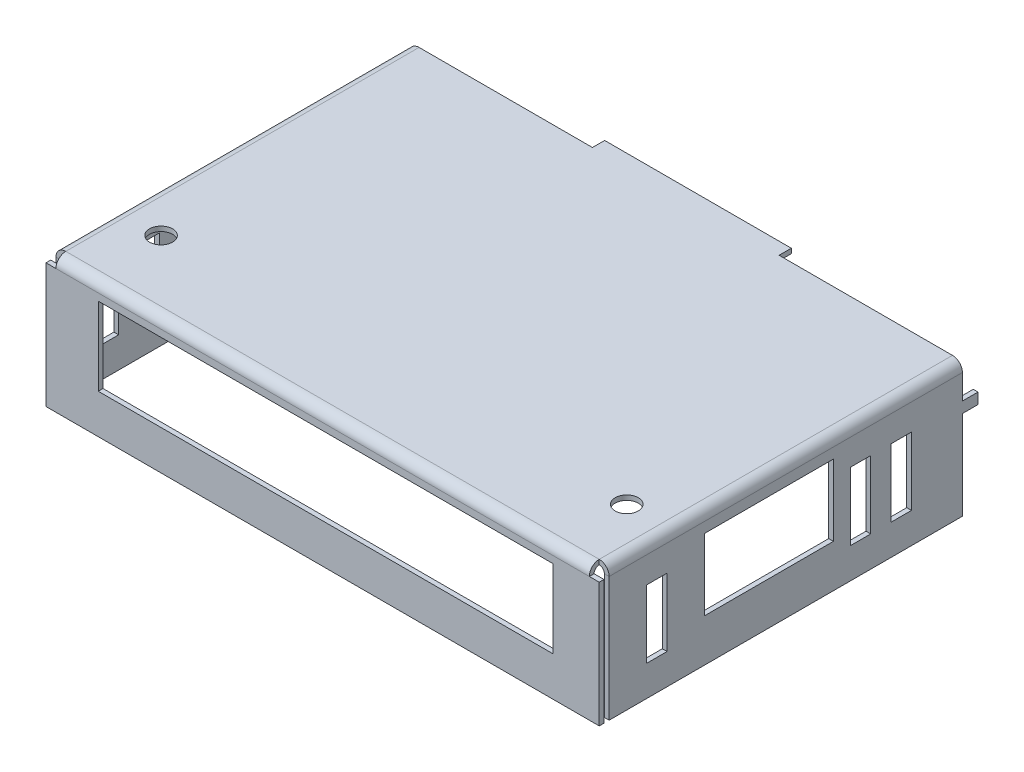
from build123d import *

# Parameters (mm, degrees)
SKETCH1_W                = 78.58
SKETCH1_H                = 52.04
BOSS_EXTRUDE1_DEPTH      = 0.7
EDGE_FLANGE2_DEPTH       = 52.04
EDGE_FLANGE1_START       = -39.29
EDGE_FLANGE1_DEPTH       = 78.58
EDGE_FLANGE1_START_2     = -40.75
EDGE_FLANGE1_2_OUTLINE_W = 18.34
EDGE_FLANGE1_2_OUTLINE_H = 0.7
EDGE_FLANGE1_2_DEPTH     = 81.5
CUT_EXTRUDE1_REACH       = 90.258
SKETCH12_W               = 3
SKETCH12_H               = 10
LPATTERN1_COUNT          = 7
LPATTERN1_PITCH          = 6
SKETCH13_W               = 3
SKETCH13_H               = 10
CUT_EXTRUDE2_DEPTH       = 88.611816555
CUT_EXTRUDE3_REACH       = 90.258
SKETCH14_W               = 19
SKETCH14_H               = 10.5
SKETCH15_W               = 0.7
SKETCH15_H               = 1.6
BOSS_EXTRUDE2_DEPTH      = 2.3
CUT_EXTRUDE4_REACH       = 73.877
SKETCH16_W               = 67
SKETCH16_H               = 11.5
SKETCH17_W               = 27.5
SKETCH17_H               = 0.7
BOSS_EXTRUDE3_DEPTH      = 1.8
M3_CLEARANCE_HOLE2_D     = 3.4


# Read off the part's stored shape, not the designer's step: Edge-Flange1
# Sheet-metal steps are written as plain solids
with BuildPart() as part:
    # Sketch1 → Boss-Extrude1 (new body)
    with BuildSketch(Plane(origin=(0, 0, 0), x_dir=(1, 0, 0), z_dir=(0, 1, 0))):
        Rectangle(SKETCH1_W, SKETCH1_H)
    extrude(amount=-BOSS_EXTRUDE1_DEPTH)

    # Edge-Flange2 section (across the edge) → Edge-Flange2 (add)
    with BuildSketch(Plane(origin=(40.05, -0.7, -26.02), x_dir=(-1, 0, 0), z_dir=(0, 0, 1))):
        with BuildLine():
            Line((-0.7, 0.76), (-0.7, 19.1))
            Line((-0.7, 19.1), (0, 19.1))
            Line((0, 19.1), (0, 0.76))
            ThreePointArc((0, 0.76), (0.222598846, 0.222598846), (0.76, 0))
            Line((0.76, 0), (0.76, -0.7))
            ThreePointArc((0.76, -0.7), (-0.272375901, -0.272375901), (-0.7, 0.76))
        make_face()
    edge_flange2 = extrude(amount=EDGE_FLANGE2_DEPTH)

    # Mirror1: Edge-Flange2 across plane
    add(edge_flange2.mirror(Plane(origin=(0, 0, 0), x_dir=(0, 0, 1), z_dir=(1, 0, 0))))

    # Edge-Flange1 outline → Edge-Flange1 (add)
    with BuildSketch(Plane.YZ.offset(EDGE_FLANGE1_START)):
        with BuildLine():
            Line((-1.46, 27.48), (-19.8, 27.48))
            Line((-19.8, 27.48), (-19.8, 26.78))
            Line((-19.8, 26.78), (-1.46, 26.78))
            ThreePointArc((-1.46, 26.78), (-0.922598846, 26.557401154), (-0.7, 26.02))
            Line((-0.7, 26.02), (0, 26.02))
            ThreePointArc((0, 26.02), (-0.427624099, 27.052375901), (-1.46, 27.48))
        make_face()
    extrude(amount=EDGE_FLANGE1_DEPTH)

    # Edge-Flange1 2 outline → Edge-Flange1 2 (add)
    with BuildSketch(Plane.YZ.offset(EDGE_FLANGE1_START_2)):
        with Locations((-10.63, 27.13)):
            Rectangle(EDGE_FLANGE1_2_OUTLINE_W, EDGE_FLANGE1_2_OUTLINE_H)
    extrude(amount=EDGE_FLANGE1_2_DEPTH)

    # Sketch12 → Cut-Extrude1 (cut, up to next)
    with BuildSketch(Plane.ZY.offset(40.75), mode=Mode.PRIVATE) as cut_extrude1_sk1:
        with Locations((-17.02, -10.3)):
            Rectangle(SKETCH12_W, SKETCH12_H)
    cut_extrude1_tool1 = extrude(cut_extrude1_sk1.sketch, amount=-CUT_EXTRUDE1_REACH, mode=Mode.PRIVATE) & part.part
    cut_extrude1 = cut_extrude1_tool1.solids().sort_by_distance((-40.75, -10.3, -17.02))[0]
    add(cut_extrude1, mode=Mode.SUBTRACT)

    # LPattern1: Cut-Extrude1 ×7
    with Locations(*[(0, 0, i * LPATTERN1_PITCH) for i in range(1, LPATTERN1_COUNT)]):
        add(cut_extrude1, mode=Mode.SUBTRACT)

    # Sketch13 → Cut-Extrude2 (cut, through all)
    with BuildSketch(Plane.ZY.offset(-40.05)):
        with Locations((18.98, -10.3)):
            Rectangle(SKETCH13_W, SKETCH13_H)
        with Locations((-11.02, -10.3)):
            Rectangle(SKETCH13_W, SKETCH13_H)
        with Locations((-17.02, -10.3)):
            Rectangle(SKETCH13_W, SKETCH13_H)
    extrude(amount=-CUT_EXTRUDE2_DEPTH, mode=Mode.SUBTRACT)

    # Sketch14 → Cut-Extrude3 (cut, up to next)
    with BuildSketch(Plane(origin=(40.75, 0, 0), x_dir=(0, 0, -1), z_dir=(1, 0, 0)), mode=Mode.PRIVATE) as cut_extrude3_sk1:
        with Locations((-2.48, -8.25)):
            Rectangle(SKETCH14_W, SKETCH14_H)
    cut_extrude3_tool1 = extrude(cut_extrude3_sk1.sketch, amount=-CUT_EXTRUDE3_REACH, mode=Mode.PRIVATE) & part.part
    add(cut_extrude3_tool1.solids().sort_by_distance((40.75, -8.25, 2.48))[0], mode=Mode.SUBTRACT)

    # Sketch15 → Boss-Extrude2 (add)
    with BuildSketch(Plane(origin=(0, 0, -26.02), x_dir=(-1, 0, 0), z_dir=(0, 0, -1))):
        with Locations((-40.4, -5.9)):
            Rectangle(SKETCH15_W, SKETCH15_H)
    boss_extrude2 = extrude(amount=BOSS_EXTRUDE2_DEPTH)

    # Mirror2: Boss-Extrude2 across plane
    add(boss_extrude2.mirror(Plane(origin=(0, 0, 0), x_dir=(0, 0, 1), z_dir=(1, 0, 0))))

    # Sketch16 → Cut-Extrude4 (cut, up to next)
    with BuildSketch(Plane.XY.offset(27.48), mode=Mode.PRIVATE) as cut_extrude4_sk1:
        with Locations((0.45, -8.25)):
            Rectangle(SKETCH16_W, SKETCH16_H)
    cut_extrude4_tool1 = extrude(cut_extrude4_sk1.sketch, amount=-CUT_EXTRUDE4_REACH, mode=Mode.PRIVATE) & part.part
    add(cut_extrude4_tool1.solids().sort_by_distance((0.45, -8.25, 27.48))[0], mode=Mode.SUBTRACT)

    # Sketch17 → Boss-Extrude3 (add)
    with BuildSketch(Plane(origin=(0, 0, -26.02), x_dir=(-1, 0, 0), z_dir=(0, 0, -1))):
        with Locations((0, -0.35)):
            Rectangle(SKETCH17_W, SKETCH17_H)
    extrude(amount=BOSS_EXTRUDE3_DEPTH)

    # M3 Clearance Hole2 (through all)
    with Locations(Plane(origin=(0, 0, 0), x_dir=(1, 0, 0), z_dir=(0, 1, 0))):
        with Locations((34.3, -16.98)):
            m3_clearance_hole2 = Hole(M3_CLEARANCE_HOLE2_D / 2)

    # Mirror3: M3 Clearance Hole2 across plane
    add(m3_clearance_hole2.mirror(Plane(origin=(0, 0, 0), x_dir=(0, 0, 1), z_dir=(1, 0, 0))), mode=Mode.SUBTRACT)


solid = part.part
